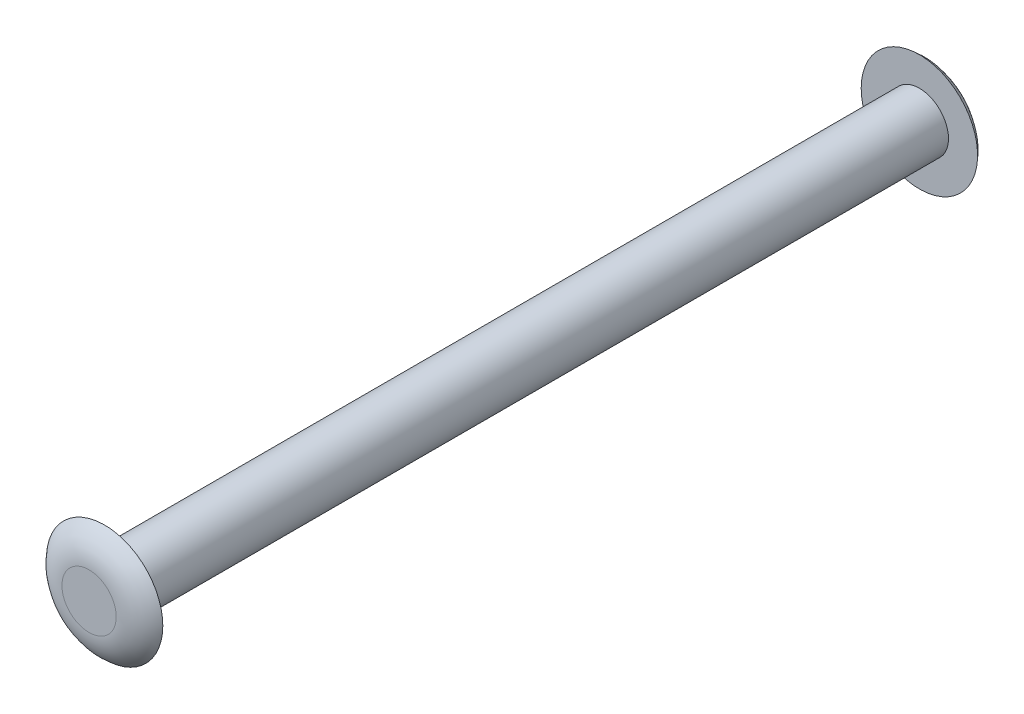
from build123d import *

# Parameters (mm, degrees)
SKETCH1_R           = 3.75
BOSS_EXTRUDE1_DEPTH = 105
SKETCH3_R           = 7.5
BOSS_EXTRUDE2_DEPTH = 2
BOSS_EXTRUDE3_START = 2
SKETCH4_R           = 7.5
BOSS_EXTRUDE3_DEPTH = 2
FILLET1_R           = 5


with BuildPart() as part:
    # Sketch1 → Boss-Extrude1 (new body)
    with BuildSketch(Plane.XY):
        Circle(SKETCH1_R)
    extrude(amount=BOSS_EXTRUDE1_DEPTH)

    # Sketch3 → Boss-Extrude2 (add)
    with BuildSketch(Plane.XY.offset(105)):
        Circle(SKETCH3_R)
    extrude(amount=BOSS_EXTRUDE2_DEPTH)

    # Sketch4 → Boss-Extrude3 (add)
    with BuildSketch(Plane(origin=(0, 0, 0), x_dir=(-1, 0, 0), z_dir=(0, 0, -1)).offset(BOSS_EXTRUDE3_START)):
        with Locations(Location((0, 0, 0), (0, 0, 180))):
            Circle(SKETCH4_R)
    extrude(amount=-BOSS_EXTRUDE3_DEPTH)

    # Fillet1
    # the kernel refuses this fillet: 5 mm, written as the material it takes off along each edge
    with BuildSketch(Plane(origin=(0, 0, -2), x_dir=(1, 0, 0), z_dir=(0, 1, 0))) as fillet1_piece_1:
        with BuildLine():
            CenterArc((3.5, -5), FILLET1_R, 36.869897646, 53.130102354)
            Line((3.5, 0), (3.5, 0.1))
            Line((3.5, 0.1), (7.5, 0.1))
            Line((7.5, 0.1), (7.6, 0))
            ThreePointArc((7.6, 0), (7.6, -1), (7.58, -1.94))
            Line((7.58, -1.94), (7.5, -2))
        make_face()
    revolve(axis=Axis((0, 0, -2), (0, 0, -1)), mode=Mode.SUBTRACT)
    with BuildSketch(Plane(origin=(0, 0, 107), x_dir=(1, 0, 0), z_dir=(0, -1, 0))) as fillet1_piece_2:
        with BuildLine():
            CenterArc((3.5, -5), FILLET1_R, 36.869897646, 53.130102354)
            Line((3.5, 0), (3.5, 0.1))
            Line((3.5, 0.1), (7.5, 0.1))
            Line((7.5, 0.1), (7.6, 0))
            ThreePointArc((7.6, 0), (7.6, -1), (7.58, -1.94))
            Line((7.58, -1.94), (7.5, -2))
        make_face()
    revolve(axis=Axis((0, 0, 107), (0, 0, 1)), mode=Mode.SUBTRACT)


solid = part.part
